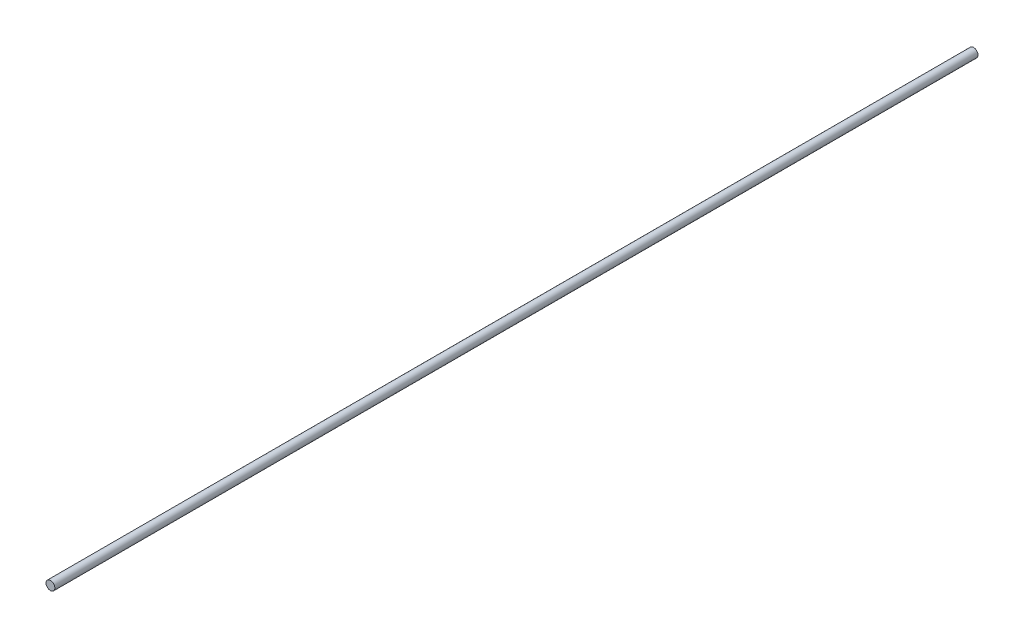
from build123d import *

# Parameters (mm, degrees)
SKETCH1_R           = 7.9375
BOSS_EXTRUDE1_DEPTH = 2254.25
SKETCH2_R           = 7.9375
CUT_EXTRUDE1_DEPTH  = 596.9


with BuildPart() as part:
    # Sketch1 → Boss-Extrude1 (new body)
    with BuildSketch(Plane.XY):
        Circle(SKETCH1_R)
    extrude(amount=BOSS_EXTRUDE1_DEPTH)

    # Sketch2 → Cut-Extrude1 (cut)
    with BuildSketch(Plane(origin=(0, 0, 0), x_dir=(-1, 0, 0), z_dir=(0, 0, -1))):
        Circle(SKETCH2_R)
    extrude(amount=-CUT_EXTRUDE1_DEPTH, mode=Mode.SUBTRACT)


solid = part.part
